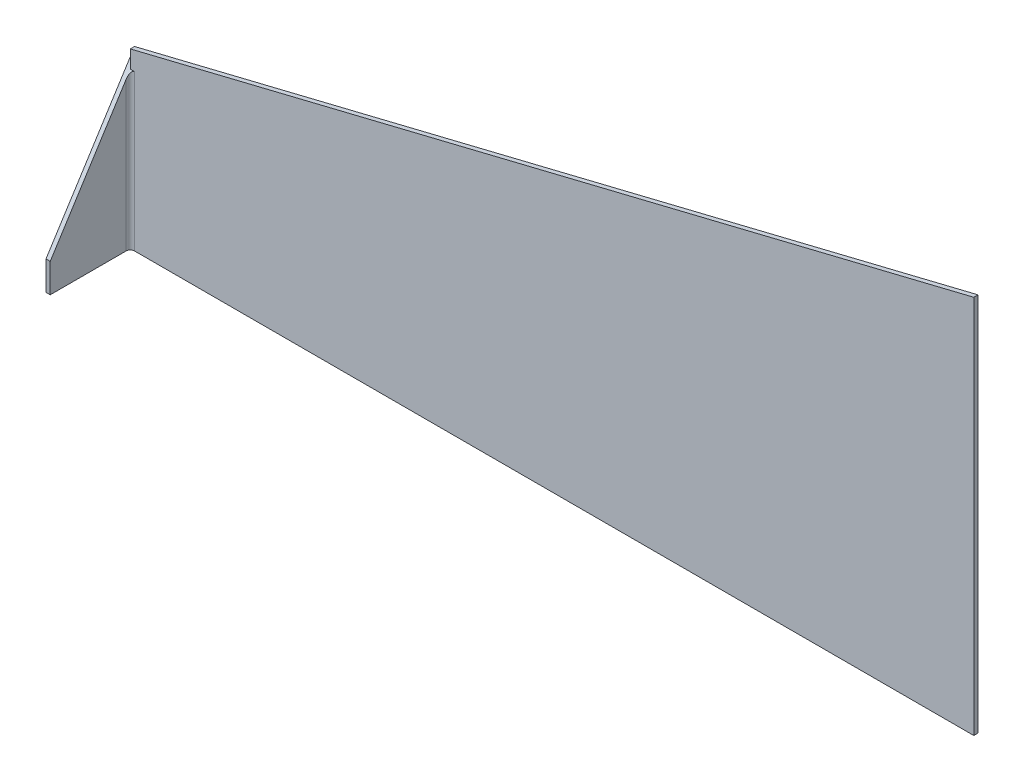
from build123d import *

# Parameters (mm, degrees)
BOSS_EXTRUDE1_DEPTH = 1
BOSS_EXTRUDE2_DEPTH = 1
FILLET1_R           = 1


with BuildPart() as part:
    # Sketch1 → Boss-Extrude1 (new body)
    with BuildSketch(Plane.XY):
        Polygon((0, 0), (-200, 0), (-200, 41), (0, 90), align=None)
    extrude(amount=BOSS_EXTRUDE1_DEPTH)

    # Sketch2 → Boss-Extrude2 (add)
    with BuildSketch(Plane.ZY.offset(200)):
        Polygon((0, 38.418342543), (20, 6.875420472), (20, 0), (0, 0), align=None)
    extrude(amount=BOSS_EXTRUDE2_DEPTH)

    # Fillet1
    fillet1_edges = [part.edges().sort_by_distance(p)[0] for p in [
        (-200, 18.42059822, 1),
    ]]
    fillet(fillet1_edges, radius=FILLET1_R)


solid = part.part
